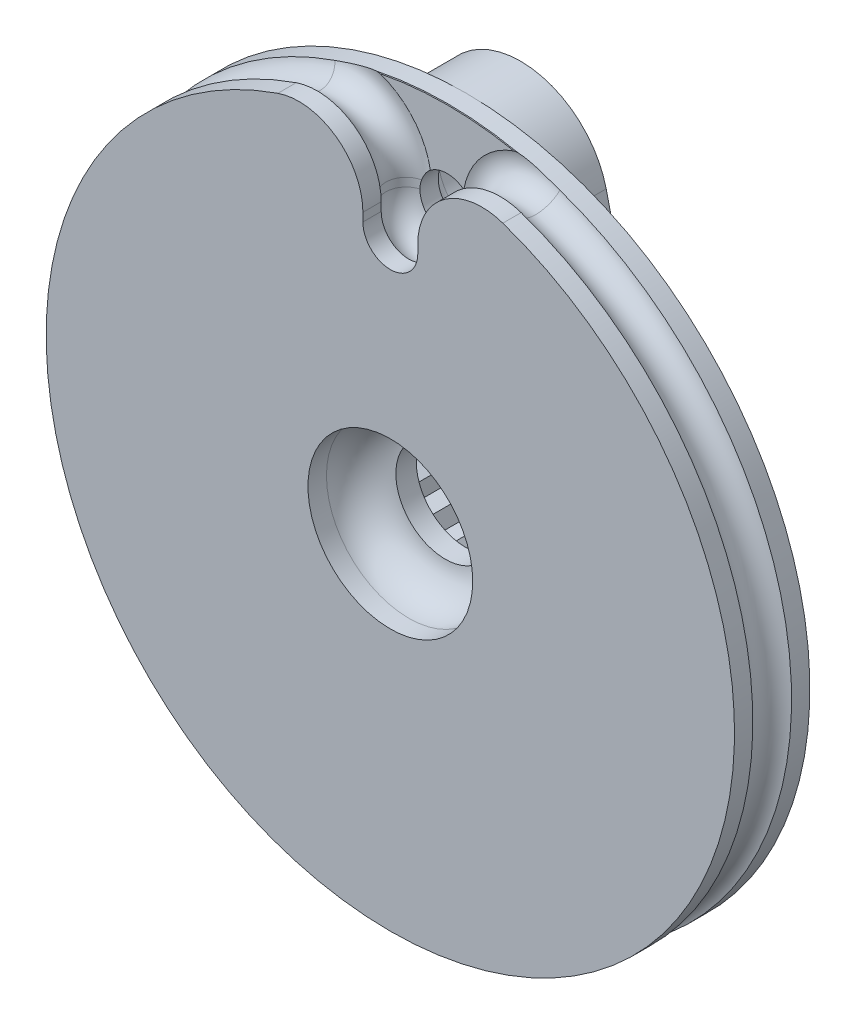
from build123d import *

# Parameters (mm, degrees)
CUT_EXTRUDE1_REACH  = 15.762
SKETCH2_R           = 1.35
SKETCH2_R_2         = 0.75
CUT_EXTRUDE2_DEPTH  = 0.8
SKETCH5_R           = 2.25
CUT_EXTRUDE4_DEPTH  = 1.5
FILLET2_R           = 1
MOVE_START          = -0.520849738
MOVE_FACE1_DEPTH    = 0.75
SKETCH7_R           = 0.55
BOSS_EXTRUDE1_START = -1.5
SKETCH8_R           = 1.25
BOSS_EXTRUDE1_DEPTH = 1.5
CUT_EXTRUDE5_DEPTH  = 1.5
CIRPATTERN1_COUNT   = 21
FILLET3_R           = 0.5


# Read off the part's stored shape, not the designer's step: Move Face1
# Some blends are built 0.0001 mm under size
with BuildPart() as part:
    # Sketch1 → Revolve1 (revolve)
    with BuildSketch(Plane(origin=(0, 0, 0), x_dir=(1, 0, 0), z_dir=(0, 1, 0))):
        with BuildLine():
            Line((-4, 1.029150262), (-9.4, 1.029150262))
            Line((-9.4, 1.029150262), (-9.4, 0.529150262))
            ThreePointArc((-9.4, 0.529150262), (-9, 0), (-9.4, -0.529150262))
            Line((-9.4, -0.529150262), (-9.4, -1.029150262))
            Line((-9.4, -1.029150262), (0, -1.029150262))
            Line((0, -1.029150262), (0, 2.529150262))
            Line((0, 2.529150262), (-4, 2.529150262))
            Line((-4, 2.529150262), (-4, 1.029150262))
        make_face()
    revolve(axis=Axis((0, 0, 0), (0, 0, 1)))

    # Sketch2 → Cut-Extrude1 (cut, up to next)
    with BuildSketch(Plane(origin=(0, 0, 1.029150262), x_dir=(-1, 0, 0), z_dir=(0, 0, -1)), mode=Mode.PRIVATE) as cut_extrude1_sk1:
        Circle(SKETCH2_R)
    cut_extrude1_tool1 = extrude(cut_extrude1_sk1.sketch, amount=CUT_EXTRUDE1_REACH, mode=Mode.PRIVATE) & part.part
    # Sketch2 → Cut-Extrude1 (cut, up to next)
    with BuildSketch(Plane(origin=(0, 0, 1.029150262), x_dir=(-1, 0, 0), z_dir=(0, 0, -1)), mode=Mode.PRIVATE) as cut_extrude1_sk2:
        with Locations((0, 7)):
            Circle(SKETCH2_R_2)
    cut_extrude1_tool2 = extrude(cut_extrude1_sk2.sketch, amount=CUT_EXTRUDE1_REACH, mode=Mode.PRIVATE) & part.part
    add(cut_extrude1_tool1.solids().sort_by_distance((0, 0, 1.02915))[0], mode=Mode.SUBTRACT)
    add(cut_extrude1_tool2.solids().sort_by_distance((0, 7, 1.02915))[0], mode=Mode.SUBTRACT)

    # Sketch3 → Cut-Extrude2 (cut)
    with BuildSketch(Plane.XY.offset(1.029150262)):
        with BuildLine():
            Line((0.75, 7), (0.75, 7.229972337))
            ThreePointArc((0.75, 7.229972337), (1.484696349, 8.655334922), (3.071895425, 8.883887578))
            ThreePointArc((3.071895425, 8.883887578), (0, 9.4), (-3.071895425, 8.883887578))
            ThreePointArc((-3.071895425, 8.883887578), (-1.484696349, 8.655334922), (-0.75, 7.229972337))
            Line((-0.75, 7.229972337), (-0.75, 7))
            ThreePointArc((-0.75, 7), (0, 6.25), (0.75, 7))
        make_face()
    extrude(amount=-CUT_EXTRUDE2_DEPTH, mode=Mode.SUBTRACT)

    # Sketch5 → Cut-Extrude4 (cut)
    with BuildSketch(Plane.XY.offset(1.029150262)):
        Circle(SKETCH5_R)
    extrude(amount=-CUT_EXTRUDE4_DEPTH, mode=Mode.SUBTRACT)

    # Fillet2
    # the kernel refuses this fillet: 1 mm, written as the material it adds along each edge
    with BuildSketch(Plane(origin=(0, 0, -0.470849738), x_dir=(1, 0, 0), z_dir=(0, -1, 0))) as fillet2_piece_1:
        with BuildLine():
            CenterArc((1.25, 0.994987437), FILLET2_R, 275.739170477, 84.260829523)
            Line((1.35, 0), (1.352, -0.019899749))
            ThreePointArc((1.352, -0.019899749), (1.8, -0.02), (2.25, -0.02))
            Line((2.25, -0.02), (2.27, 0))
            Line((2.27, 0), (2.27, 0.994987437))
            Line((2.27, 0.994987437), (2.25, 0.994987437))
        make_face()
    revolve(axis=Axis((0, 0, -0.470849738), (0, 0, 1)))

    # Move Face1 outline → Move Face1 (cut)
    with BuildSketch(Plane.XY.offset(MOVE_START)):
        with BuildLine():
            ThreePointArc((-3.071895425, 8.883887578), (-1.484696349, 8.655334922), (-0.75, 7.229972337))
            Line((-0.75, 7.229972337), (-0.75, 7))
            ThreePointArc((-0.75, 7), (0, 7.75), (0.75, 7))
            Line((0.75, 7), (0.75, 7.229972337))
            ThreePointArc((0.75, 7.229972337), (1.484696349, 8.655334922), (3.071895425, 8.883887578))
            Line((3.071895425, 8.883887578), (4, 8.562964989))
            Line((4, 8.562964989), (4, 11))
            Line((4, 11), (-4, 11))
            Line((-4, 11), (-4, 8.562964989))
            Line((-4, 8.562964989), (-3.071895425, 8.883887578))
        make_face()
    extrude(amount=MOVE_FACE1_DEPTH, mode=Mode.SUBTRACT)

    # Cut-Sweep2: sweep along a path in Sketch6
    with BuildLine(Plane.XY) as cut_sweep2_path:
        ThreePointArc((3.071895425, 8.883887578), (1.484696349, 8.655334922), (0.75, 7.229972337))
        Line((0.75, 7.229972337), (0.75, 7))
        ThreePointArc((0.75, 7), (0, 6.25), (-0.75, 7))
        Line((-0.75, 7), (-0.75, 7.229972337))
        ThreePointArc((-0.75, 7.229972337), (-1.484696349, 8.655334922), (-3.071895425, 8.883887578))
    # Sketch7 → Cut-Sweep2 (sweep, cut)
    with BuildSketch(Plane(origin=(0, 0, 0), x_dir=(0, 0, -1), z_dir=(1, 0, 0))):
        with Locations((0, 6.4)):
            Circle(SKETCH7_R)
    sweep(path=cut_sweep2_path.line, mode=Mode.SUBTRACT)

    # Sketch8 → Boss-Extrude1 (add)
    with BuildSketch(Plane(origin=(0, 0, -2.529150262), x_dir=(-1, 0, 0), z_dir=(0, 0, -1)).offset(BOSS_EXTRUDE1_START)):
        with BuildLine():
            Line((-3.89410858, 0.914285714), (-2.336465148, 7.548571429))
            ThreePointArc((-2.336465148, 7.548571429), (0, 9.4), (2.336465148, 7.548571429))
            Line((2.336465148, 7.548571429), (3.89410858, 0.914285714))
            ThreePointArc((3.89410858, 0.914285714), (0, 4), (-3.89410858, 0.914285714))
        make_face()
        with Locations((0, 7)):
            Circle(SKETCH8_R, mode=Mode.SUBTRACT)
    extrude(amount=BOSS_EXTRUDE1_DEPTH)

    # Sketch9 → Cut-Extrude5 (cut)
    with BuildSketch(Plane(origin=(0, 0, -2.529150262), x_dir=(-1, 0, 0), z_dir=(0, 0, -1))):
        Polygon((0, 0), (0, 2.281232088), (0.372605665, 2.472077066), (0.672404962, 2.179883347), align=None)
    cut_extrude5 = extrude(amount=-CUT_EXTRUDE5_DEPTH, mode=Mode.SUBTRACT)

    # CirPattern1: Cut-Extrude5 ×21 about axis
    cirpattern1_axis = Axis((0, 0, 0), (0, 0, 1))
    for i in range(1, CIRPATTERN1_COUNT):
        add(cut_extrude5.rotate(cirpattern1_axis, i * 360 / CIRPATTERN1_COUNT), mode=Mode.SUBTRACT)

    # Fillet3
    fillet3_edges = [part.edges().sort_by_distance(p)[0] for p in [
        (1.25, 7, -1.029150262),
    ]]
    fillet(fillet3_edges, radius=FILLET3_R - 0.0001)  # a hair under: the kernel refuses the full size


solid = part.part
